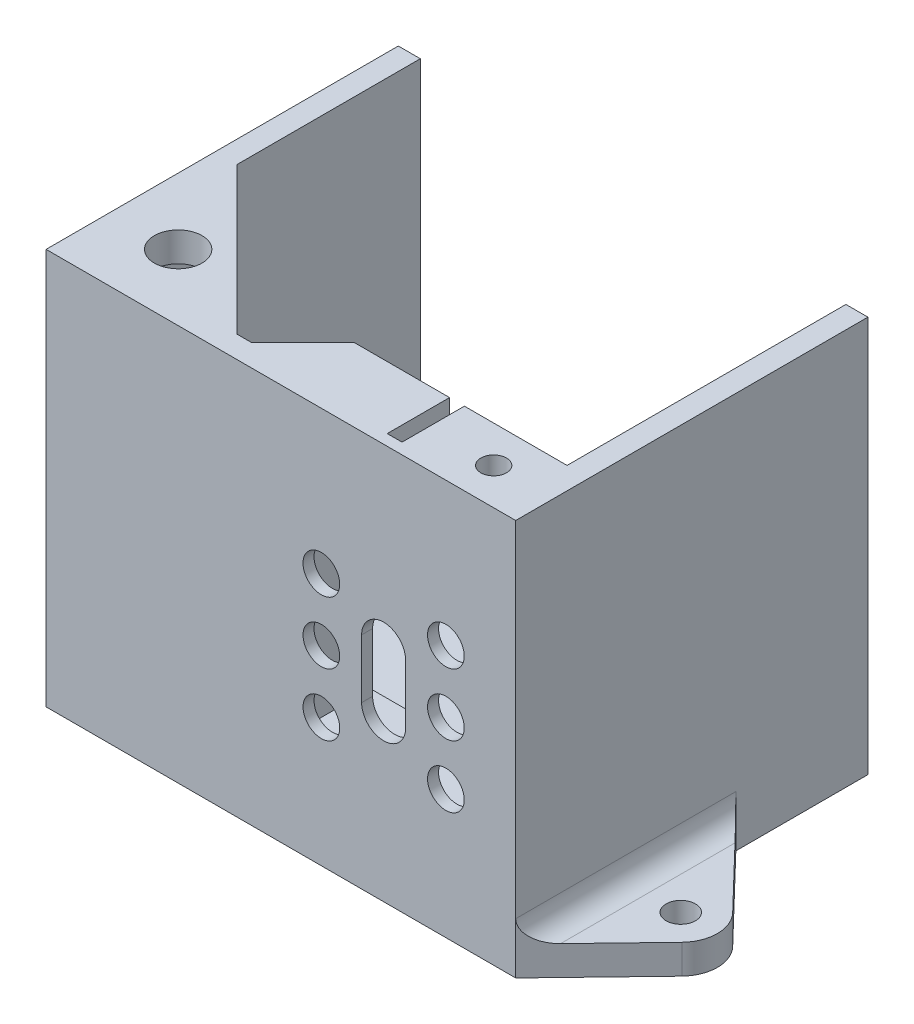
from build123d import *

# Parameters (mm, degrees)
SKETCH1_W           = 64
SKETCH1_H           = 48
BOSS_EXTRUDE1_DEPTH = 4
CUT_EXTRUDE1_DEPTH  = 2.4
CUT_EXTRUDE2_DEPTH  = 2.4
BOSS_EXTRUDE3_DEPTH = 50
BOSS_EXTRUDE4_DEPTH = 50
CUT_EXTRUDE4_DEPTH  = 9.5
SKETCH13_W          = 36.946258726
SKETCH13_H          = 1
CUT_EXTRUDE6_DEPTH  = 32
SKETCH15_R          = 3.25
BOSS_EXTRUDE5_DEPTH = 4
CUT_EXTRUDE7_DEPTH  = 7
SKETCH18_W          = 5.8
SKETCH18_H          = 2.6
CUT_EXTRUDE8_DEPTH  = 5
SKETCH19_R          = 1.75
BOSS_EXTRUDE8_DEPTH = 4.4
FILLET1_R           = 1.5
SKETCH20_R          = 2
BOSS_EXTRUDE9_DEPTH = 4
FILLET2_R           = 3
SKETCH22_R          = 1.75
CUT_EXTRUDE9_DEPTH  = 2
SKETCH23_R          = 2.5
CUT_EXTRUDE10_DEPTH = 3


with BuildPart() as part:
    # Sketch1 → Boss-Extrude1 (new body)
    with BuildSketch(Plane(origin=(0, 0, 0), x_dir=(1, 0, 0), z_dir=(0, 1, 0))):
        Rectangle(SKETCH1_W, SKETCH1_H)
    extrude(amount=BOSS_EXTRUDE1_DEPTH)

    # Sketch2 → Cut-Extrude1 (cut)
    with BuildSketch(Plane.XZ):
        Polygon((-20.651368439, -16), (-22.325684219, -13.1), (-25.674315781, -13.1), (-27.348631561, -16), (-25.674315781, -18.9), (-22.325684219, -18.9), align=None)
    extrude(amount=-CUT_EXTRUDE1_DEPTH, mode=Mode.SUBTRACT)

    # Sketch4 → Cut-Extrude2 (cut)
    with BuildSketch(Plane.XZ):
        Polygon((9.348631561, 10), (7.674315781, 12.9), (4.325684219, 12.9), (2.651368439, 10), (4.325684219, 7.1), (7.674315781, 7.1), align=None)
    extrude(amount=-CUT_EXTRUDE2_DEPTH, mode=Mode.SUBTRACT)

    # Sketch6 → Boss-Extrude3 (add)
    with BuildSketch(Plane(origin=(0, 4, 0), x_dir=(1, 0, 0), z_dir=(0, 1, 0))):
        Polygon((-29, -21), (-29, 21), (-29, 24), (-32, 24), (-32, -24), (32, -24), (32, 24), (29, 24), (29, 21), (29, -21), align=None)
    extrude(amount=BOSS_EXTRUDE3_DEPTH)

    # Sketch9 → Boss-Extrude4 (add)
    with BuildSketch(Plane(origin=(0, 4, 0), x_dir=(1, 0, 0), z_dir=(0, 1, 0))):
        Polygon((29, -13), (1, -13), (-7, -21), (29, -21), align=None)
    extrude(amount=BOSS_EXTRUDE4_DEPTH)

    # Sketch10 → Cut-Extrude4 (cut)
    with BuildSketch(Plane(origin=(0, 0, 13), x_dir=(-1, 0, 0), z_dir=(0, 0, -1))):
        Polygon((-15.011861685, 38.75), (-26.75, 38.75), (-26.75, 13.25), (-1.25, 13.25), (-1.25, 38.75), (-12.988138315, 38.75), (-12.988138315, 54), (-15.011861685, 54), align=None)
    extrude(amount=-CUT_EXTRUDE4_DEPTH, mode=Mode.SUBTRACT)

    # Sketch13 → Cut-Extrude6 (cut)
    with BuildSketch(Plane(origin=(0, 54, 0), x_dir=(1, 0, 0), z_dir=(0, 1, 0))):
        with Locations((10.526870637, -13.5)):
            Rectangle(SKETCH13_W, SKETCH13_H)
    extrude(amount=-CUT_EXTRUDE6_DEPTH, mode=Mode.SUBTRACT)

    # Sketch15 → Boss-Extrude5 (add)
    with BuildSketch(Plane(origin=(0, 54, 0), x_dir=(1, 0, 0), z_dir=(0, 1, 0))):
        Polygon((-29, -1), (-9, -21), (-29, -21), align=None)
        with Locations((-23, -15)):
            Circle(SKETCH15_R, mode=Mode.SUBTRACT)
    extrude(amount=-BOSS_EXTRUDE5_DEPTH)

    # Sketch17 → Cut-Extrude7 (cut)
    with BuildSketch(Plane(origin=(0, 54, 0), x_dir=(1, 0, 0), z_dir=(0, 1, 0))):
        Polygon((24, -15.651368439), (21.1, -17.325684219), (21.1, -20.674315781), (24, -22.348631561), (26.9, -20.674315781), (26.9, -17.325684219), align=None)
    extrude(amount=-CUT_EXTRUDE7_DEPTH, mode=Mode.SUBTRACT)

    # Sketch18 → Cut-Extrude8 (cut)
    with BuildSketch(Plane(origin=(0, 0, 14), x_dir=(-1, 0, 0), z_dir=(0, 0, -1))):
        with Locations((-24, 48.3)):
            Rectangle(SKETCH18_W, SKETCH18_H)
    extrude(amount=-CUT_EXTRUDE8_DEPTH, mode=Mode.SUBTRACT)

    # Sketch19 → Boss-Extrude8 (add)
    with BuildSketch(Plane(origin=(0, 54, 0), x_dir=(1, 0, 0), z_dir=(0, 1, 0))):
        Polygon((26.9, -17.325684219), (24, -15.651368439), (21.1, -17.325684219), (21.1, -20.674315781), (24, -22.348631561), (26.9, -20.674315781), align=None)
        with Locations((24, -19)):
            Circle(SKETCH19_R, mode=Mode.SUBTRACT)
    extrude(amount=-BOSS_EXTRUDE8_DEPTH)

    # Fillet1
    fillet1_edges = [part.edges().sort_by_distance(p)[0] for p in [
        (-29, 50, 11),
        (-19, 50, 21),
    ]]
    fillet(fillet1_edges, radius=FILLET1_R)

    # Sketch20 → Boss-Extrude9 (add)
    # profile 1 of 2: a face of its own
    with BuildSketch(Plane.XZ):
        with BuildLine():
            Line((43.102082828, 12.467708073), (32.000000003, 23.999999995))
            Line((32.000000003, 23.999999995), (32, -6.000000006))
            Line((32, -6.000000006), (43.102082819, 5.532291906))
            ThreePointArc((43.102082819, 5.532291906), (44.500000003, 8.999999988), (43.102082828, 12.467708073))
        make_face()
        with Locations((39.500000002, 8.999999994)):
            Circle(SKETCH20_R, mode=Mode.SUBTRACT)
    # profile 2 of 2: a face of its own
    with BuildSketch(Plane.XZ):
        with BuildLine():
            Line((-32, -24), (-32, 2.000000002))
            Line((-32, 2.000000002), (-42.978939192, -7.408763151))
            ThreePointArc((-42.978939192, -7.408763151), (-44.499999999, -10.999999999), (-42.978939192, -14.591236846))
            Line((-42.978939192, -14.591236846), (-32, -24))
        make_face()
        with Locations((-39.499999999, -10.999999999)):
            Circle(SKETCH20_R, mode=Mode.SUBTRACT)
    extrude(amount=-BOSS_EXTRUDE9_DEPTH)

    # Fillet2
    fillet2_edges = [part.edges().sort_by_distance(p)[0] for p in [
        (-32, 4, -10.999999999),
        (32.000000002, 4, 8.999999995),
    ]]
    fillet(fillet2_edges, radius=FILLET2_R)

    # Sketch22 → Cut-Extrude9 (cut)
    with BuildSketch(Plane.XZ.offset(-2.4)):
        with Locations((-24, -16)):
            Circle(SKETCH22_R)
        with Locations((6, 10)):
            Circle(SKETCH22_R)
    extrude(amount=-CUT_EXTRUDE9_DEPTH, mode=Mode.SUBTRACT)

    # Sketch23 → Cut-Extrude10 (cut)
    with BuildSketch(Plane(origin=(0, 0, 22.5), x_dir=(-1, 0, 0), z_dir=(0, 0, -1))):
        with Locations((-22.485281374, 34.485281374)):
            Circle(SKETCH23_R)
        with Locations((-5.514718626, 34.485281374)):
            Circle(SKETCH23_R)
        with Locations((-5.514718626, 17.514718626)):
            Circle(SKETCH23_R)
        with Locations((-22.485281374, 17.514718626)):
            Circle(SKETCH23_R)
        with Locations((-22.485281374, 26)):
            Circle(SKETCH23_R)
        with Locations((-5.514718626, 26)):
            Circle(SKETCH23_R)
        with BuildLine():
            Line((-11, 30), (-11, 22))
            ThreePointArc((-11, 22), (-14, 19), (-17, 22))
            Line((-17, 22), (-17, 30))
            ThreePointArc((-17, 30), (-14, 33), (-11, 30))
        make_face()
    extrude(amount=-CUT_EXTRUDE10_DEPTH, mode=Mode.SUBTRACT)


solid = part.part
